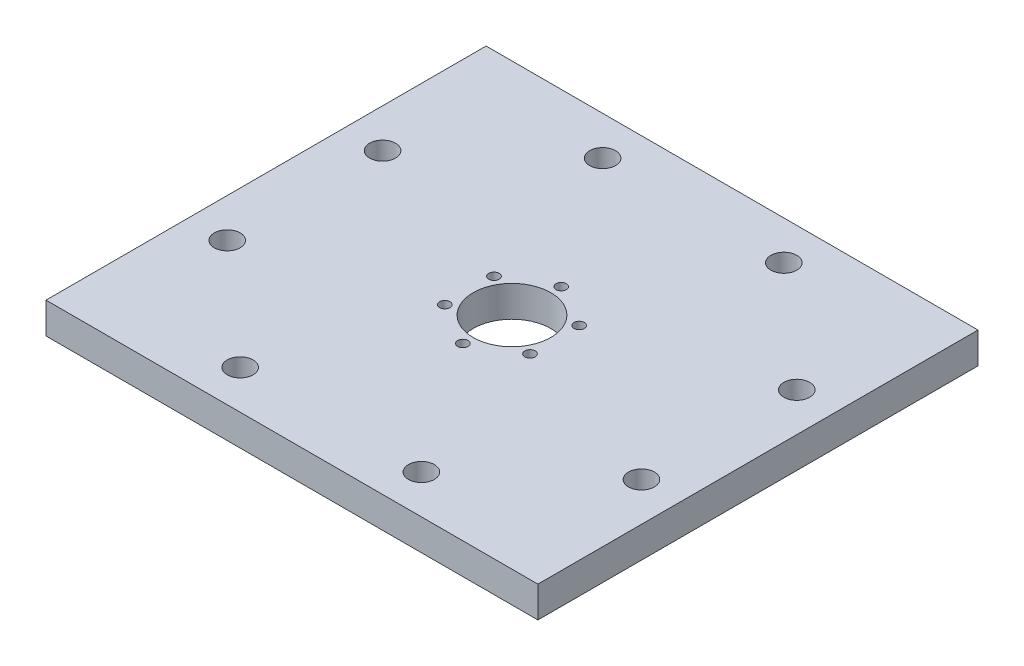
from build123d import *

# Parameters (mm, degrees)
SKETCH1_W           = 95
SKETCH1_H           = 85
SKETCH1_R           = 1
SKETCH1_R_2         = 7.5
SKETCH1_R_3         = 2.5
BOSS_EXTRUDE1_DEPTH = 6
SKETCH2_R           = 6
CUT_EXTRUDE2_DEPTH  = 1.5


with BuildPart() as part:
    # Sketch1 → Boss-Extrude1 (new body)
    with BuildSketch(Plane(origin=(0, 0, 0), x_dir=(1, 0, 0), z_dir=(0, 1, 0))):
        Rectangle(SKETCH1_W, SKETCH1_H)
        with Locations((0, 9.5)):
            Circle(SKETCH1_R, mode=Mode.SUBTRACT)
        with Locations((8.227241336, 4.75)):
            Circle(SKETCH1_R, mode=Mode.SUBTRACT)
        with Locations((8.227241336, -4.75)):
            Circle(SKETCH1_R, mode=Mode.SUBTRACT)
        with Locations((0, -9.5)):
            Circle(SKETCH1_R, mode=Mode.SUBTRACT)
        with Locations((-8.227241336, -4.75)):
            Circle(SKETCH1_R, mode=Mode.SUBTRACT)
        with Locations((-8.227241336, 4.75)):
            Circle(SKETCH1_R, mode=Mode.SUBTRACT)
        Circle(SKETCH1_R_2, mode=Mode.SUBTRACT)
        with Locations((-17.5, 35)):
            Circle(SKETCH1_R_3, mode=Mode.SUBTRACT)
        with Locations((17.5, 35)):
            Circle(SKETCH1_R_3, mode=Mode.SUBTRACT)
        with Locations((17.5, -35)):
            Circle(SKETCH1_R_3, mode=Mode.SUBTRACT)
        with Locations((-17.5, -35)):
            Circle(SKETCH1_R_3, mode=Mode.SUBTRACT)
        with Locations((-40, 15)):
            Circle(SKETCH1_R_3, mode=Mode.SUBTRACT)
        with Locations((-40, -15)):
            Circle(SKETCH1_R_3, mode=Mode.SUBTRACT)
        with Locations((40, -15)):
            Circle(SKETCH1_R_3, mode=Mode.SUBTRACT)
        with Locations((40, 15)):
            Circle(SKETCH1_R_3, mode=Mode.SUBTRACT)
    extrude(amount=BOSS_EXTRUDE1_DEPTH)

    # Sketch2 → Cut-Extrude2 (cut)
    with BuildSketch(Plane(origin=(0, 0, 0), x_dir=(1, 0, 0), z_dir=(0, 1, 0))):
        with Locations((-17.5, 35)):
            Circle(SKETCH2_R)
        with Locations((-17.5, -35)):
            Circle(SKETCH2_R)
        with Locations((17.5, -35)):
            Circle(SKETCH2_R)
        with Locations((17.5, 35)):
            Circle(SKETCH2_R)
    extrude(amount=CUT_EXTRUDE2_DEPTH, mode=Mode.SUBTRACT)


solid = part.part
